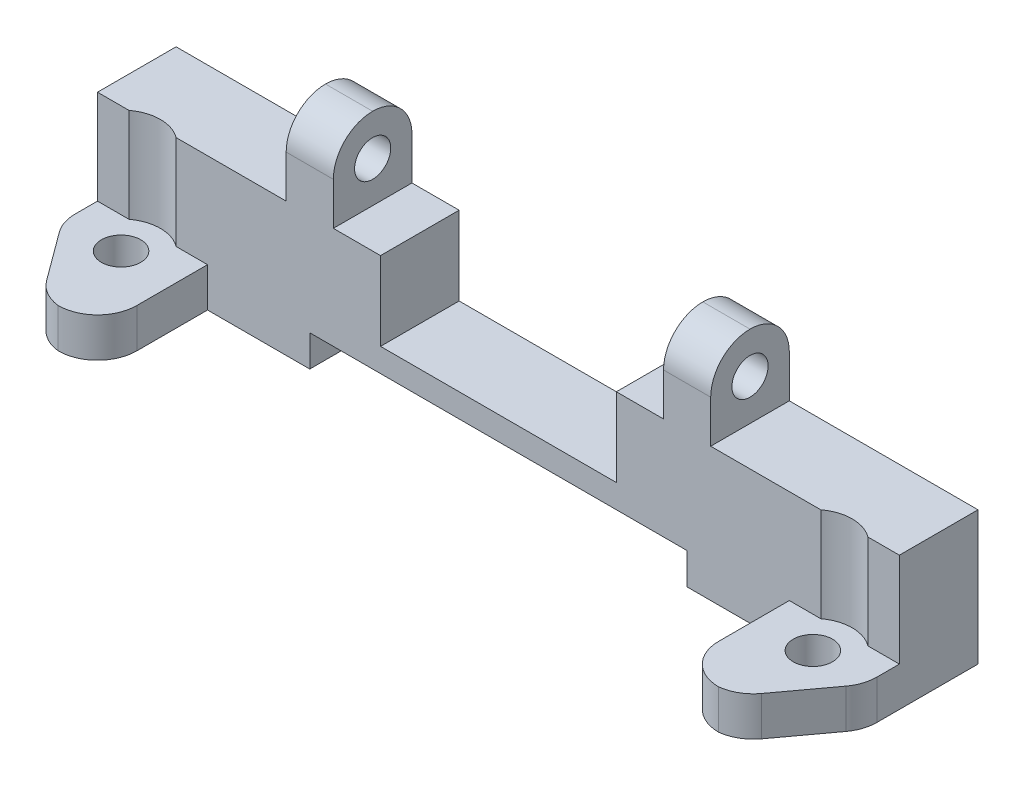
from build123d import *

# Parameters (mm, degrees)
SKETCH1_W           = 51
SKETCH1_H           = 5
BOSS_EXTRUDE1_DEPTH = 8.5
SKETCH2_W           = 15
SKETCH2_H           = 5
CUT_EXTRUDE1_DEPTH  = 5
SKETCH3_W           = 24
SKETCH3_H           = 5
CUT_EXTRUDE2_DEPTH  = 2
SKETCH4_W           = 7
SKETCH4_H           = 2.5
BOSS_EXTRUDE2_DEPTH = 7
SKETCH5_W           = 3
SKETCH5_H           = 5
BOSS_EXTRUDE3_DEPTH = 5.2
SKETCH6_R           = 1.25
CUT_EXTRUDE3_DEPTH  = 30.42685848
SKETCH7_R           = 0.75
CUT_EXTRUDE4_DEPTH  = 5
SKETCH8_R           = 1.15
CUT_EXTRUDE5_DEPTH  = 43.413912812
SKETCH9_R           = 2.5
CUT_EXTRUDE6_DEPTH  = 6
FILLET1_R           = 2.5
CUT_EXTRUDE7_DEPTH  = 30.42685848
FILLET2_R           = 2.5


with BuildPart() as part:
    # Sketch1 → Boss-Extrude1 (new body)
    with BuildSketch(Plane(origin=(0, 0, 0), x_dir=(1, 0, 0), z_dir=(0, 1, 0))):
        Rectangle(SKETCH1_W, SKETCH1_H)
    extrude(amount=BOSS_EXTRUDE1_DEPTH)

    # Sketch2 → Cut-Extrude1 (cut)
    with BuildSketch(Plane(origin=(0, 8.5, 0), x_dir=(1, 0, 0), z_dir=(0, 1, 0))):
        Rectangle(SKETCH2_W, SKETCH2_H)
    extrude(amount=-CUT_EXTRUDE1_DEPTH, mode=Mode.SUBTRACT)

    # Sketch3 → Cut-Extrude2 (cut)
    with BuildSketch(Plane.XZ):
        Rectangle(SKETCH3_W, SKETCH3_H)
    extrude(amount=-CUT_EXTRUDE2_DEPTH, mode=Mode.SUBTRACT)

    # Sketch4 → Boss-Extrude2 (add)
    with BuildSketch(Plane.XY.offset(2.5)):
        with Locations((-22, 1.25)):
            Rectangle(SKETCH4_W, SKETCH4_H)
        with Locations((22, 1.25)):
            Rectangle(SKETCH4_W, SKETCH4_H)
    extrude(amount=BOSS_EXTRUDE2_DEPTH)

    # Sketch5 → Boss-Extrude3 (add)
    with BuildSketch(Plane(origin=(0, 8.5, 0), x_dir=(1, 0, 0), z_dir=(0, 1, 0))):
        with Locations((-12, 0)):
            Rectangle(SKETCH5_W, SKETCH5_H)
        with Locations((12, 0)):
            Rectangle(SKETCH5_W, SKETCH5_H)
    extrude(amount=BOSS_EXTRUDE3_DEPTH)

    # Sketch6 → Cut-Extrude3 (cut, through all)
    with BuildSketch(Plane(origin=(0, 2.5, 0), x_dir=(1, 0, 0), z_dir=(0, 1, 0))):
        with Locations(Location((-22, -4.5, 0), (0, 0, 270))):
            Circle(SKETCH6_R)
        with Locations(Location((22, -4.5, 0), (0, 0, 270))):
            Circle(SKETCH6_R)
    extrude(amount=-CUT_EXTRUDE3_DEPTH, mode=Mode.SUBTRACT)

    # Sketch7 → Cut-Extrude4 (cut)
    with BuildSketch(Plane.XZ.offset(-2)):
        with Locations(Location((-8.5, 0.5, 0), (0, 0, 270))):
            Circle(SKETCH7_R)
        with Locations(Location((8.5, 0.5, 0), (0, 0, 270))):
            Circle(SKETCH7_R)
    extrude(amount=-CUT_EXTRUDE4_DEPTH, mode=Mode.SUBTRACT)

    # Sketch8 → Cut-Extrude5 (cut, through all)
    with BuildSketch(Plane.ZY.offset(13.5)):
        with Locations((0, 11.1)):
            Circle(SKETCH8_R)
    extrude(amount=-CUT_EXTRUDE5_DEPTH, mode=Mode.SUBTRACT)

    # Sketch9 → Cut-Extrude6 (cut)
    with BuildSketch(Plane(origin=(0, 8.5, 0), x_dir=(1, 0, 0), z_dir=(0, 1, 0))):
        with Locations((-22, -4.5)):
            Circle(SKETCH9_R)
        with Locations((22, -4.5)):
            Circle(SKETCH9_R)
    extrude(amount=-CUT_EXTRUDE6_DEPTH, mode=Mode.SUBTRACT)

    # Fillet1
    # the kernel refuses this fillet: 2.5 mm, written as the material it takes off along each edge
    with BuildSketch(Plane(origin=(-25.5, -6.25, 9.5), x_dir=(0, 0, -1), z_dir=(0, 1, 0)), Plane(origin=(-18.5, 8.75, 9.5), x_dir=(0, 0, -1), z_dir=(0, -1, 0))) as fillet1_piece_1:
        with BuildLine():
            CenterArc((FILLET1_R, -FILLET1_R), FILLET1_R, 90, 90)
            Line((0, -FILLET1_R), (0, 0))
            Line((0, 0), (FILLET1_R, 0))
        make_face()
    extrude(amount=15, mode=Mode.SUBTRACT)
    with BuildSketch(Plane(origin=(18.5, 8.75, 9.5), x_dir=(0, 0, -1), z_dir=(0, -1, 0)), Plane(origin=(25.5, -6.25, 9.5), x_dir=(0, 0, -1), z_dir=(0, 1, 0))) as fillet1_piece_2:
        with BuildLine():
            CenterArc((FILLET1_R, FILLET1_R), FILLET1_R, 180, 90)
            Line((0, FILLET1_R), (0, 0))
            Line((0, 0), (FILLET1_R, 0))
        make_face()
    extrude(amount=15, mode=Mode.SUBTRACT)
    with BuildSketch(Plane(origin=(-4.25, 13.7, -2.5), x_dir=(0, 0, 1), z_dir=(-1, 0, 0)), Plane(origin=(19.75, 13.7, 2.5), x_dir=(0, -1, 0), z_dir=(-1, 0, 0))) as fillet1_piece_3:
        with BuildLine():
            CenterArc((FILLET1_R, -FILLET1_R), FILLET1_R, 90, 90)
            Line((0, -FILLET1_R), (0, 0))
            Line((0, 0), (FILLET1_R, 0))
        make_face()
    extrude(amount=15.5, mode=Mode.SUBTRACT)
    with BuildSketch(Plane(origin=(-19.75, 13.7, 2.5), x_dir=(0, -1, 0), z_dir=(1, 0, 0)), Plane(origin=(4.25, 13.7, -2.5), x_dir=(0, 0, 1), z_dir=(1, 0, 0))) as fillet1_piece_4:
        with BuildLine():
            CenterArc((FILLET1_R, FILLET1_R), FILLET1_R, 180, 90)
            Line((0, FILLET1_R), (0, 0))
            Line((0, 0), (FILLET1_R, 0))
        make_face()
    extrude(amount=15.5, mode=Mode.SUBTRACT)

    # Sketch10 → Cut-Extrude7 (cut, through all)
    with BuildSketch(Plane(origin=(0, 2.5, 0), x_dir=(1, 0, 0), z_dir=(0, 1, 0))):
        Polygon((-25.5, -4.75), (-22, -9.5), (-25.5, -9.5), align=None)
        Polygon((25.5, -4.75), (25.5, -9.5), (22, -9.5), align=None)
    extrude(amount=-CUT_EXTRUDE7_DEPTH, mode=Mode.SUBTRACT)

    # Fillet2
    # the kernel refuses this fillet: 2.5 mm, written as the material it takes off along each edge
    with BuildSketch(Plane(origin=(25.5, 4.553949751, 4.75), x_dir=(-0.5931990380498499, 0, 0.8050558373533682), z_dir=(0, -1, 0)), Plane(origin=(-25.5, 4.553949751, 4.75), x_dir=(0, 0, -1), z_dir=(0, -1, 0))) as fillet2_piece_1:
        with BuildLine():
            CenterArc((FILLET2_R * 0.328631960172, FILLET2_R), FILLET2_R, 233.615648184, 36.384351816)
            Line((-FILLET2_R * 0.264567077878, FILLET2_R * 0.194944162647), (-FILLET2_R * 0.276431058639, FILLET2_R * 0.1788430459))
            Line((-FILLET2_R * 0.276431058639, FILLET2_R * 0.1788430459), (-FILLET2_R * 0.00657263920345, -FILLET2_R * 0.02))
            Line((-FILLET2_R * 0.00657263920345, -FILLET2_R * 0.02), (FILLET2_R * 0.328631960172, -FILLET2_R * 0.02))
            Line((FILLET2_R * 0.328631960172, -FILLET2_R * 0.02), (FILLET2_R * 0.328631960172, 0))
        make_face()
    extrude(amount=6.607899502, mode=Mode.SUBTRACT)
    with BuildSketch(Plane(origin=(22, 5.611268046, 9.5), x_dir=(-1, 0, 0), z_dir=(0, -1, 0))) as fillet2_piece_2:
        with BuildLine():
            CenterArc((1.274399108, 2.484895396), FILLET2_R, 216.384351816, 47.314187929)
            Line((-0.738240485, 1.001897801), (-0.778493277, 0.972237849))
            Line((-0.778493277, 0.972237849), (-0.040252792, -0.029659952))
            Line((-0.040252792, -0.029659952), (0, -0.05))
            ThreePointArc((0, -0.05), (0.5, -0.05), (0.994512018, -0.049697908))
            Line((0.994512018, -0.049697908), (1, 0))
        make_face()
    extrude(amount=8.722536093, mode=Mode.SUBTRACT)
    with BuildSketch(Plane(origin=(-22, 5.611268046, 9.5), x_dir=(-0.5931990380498491, 0, -0.8050558373533688), z_dir=(0, -1, 0))) as fillet2_piece_3:
        with BuildLine():
            CenterArc((1.244507219, 2.5), FILLET2_R, 222.685812071, 47.314187929)
            Line((-0.593199038, 0.805055837), (-0.629953163, 0.771156954))
            ThreePointArc((-0.629953163, 0.771156954), (-0.336852311, 0.372867967), (-0.040252792, -0.029659952))
            Line((-0.040252792, -0.029659952), (0, -0.05))
            Line((0, -0.05), (1.244507219, -0.05))
            Line((1.244507219, -0.05), (1.244507219, 0))
        make_face()
    extrude(amount=8.722536093, mode=Mode.SUBTRACT)


solid = part.part
